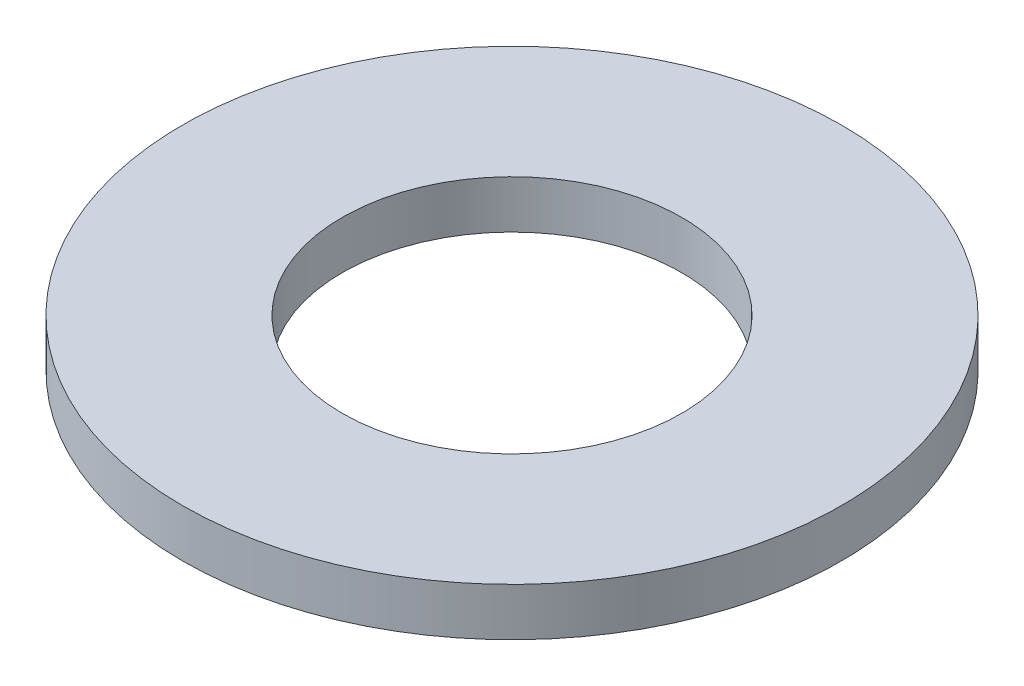
from build123d import *

# Parameters (mm, degrees)
SKETCH1_R           = 82.5
BOSS_EXTRUDE1_DEPTH = 12
SKETCH2_R           = 42.5
CUT_EXTRUDE1_DEPTH  = 118.288106814


with BuildPart() as part:
    # Sketch1 → Boss-Extrude1 (new body)
    with BuildSketch(Plane(origin=(0, 0, 0), x_dir=(1, 0, 0), z_dir=(0, 1, 0))):
        Circle(SKETCH1_R)
    extrude(amount=BOSS_EXTRUDE1_DEPTH)

    # Sketch2 → Cut-Extrude1 (cut, through all)
    with BuildSketch(Plane(origin=(0, 0, 0), x_dir=(1, 0, 0), z_dir=(0, 1, 0))):
        Circle(SKETCH2_R)
    extrude(amount=CUT_EXTRUDE1_DEPTH, mode=Mode.SUBTRACT)


solid = part.part
